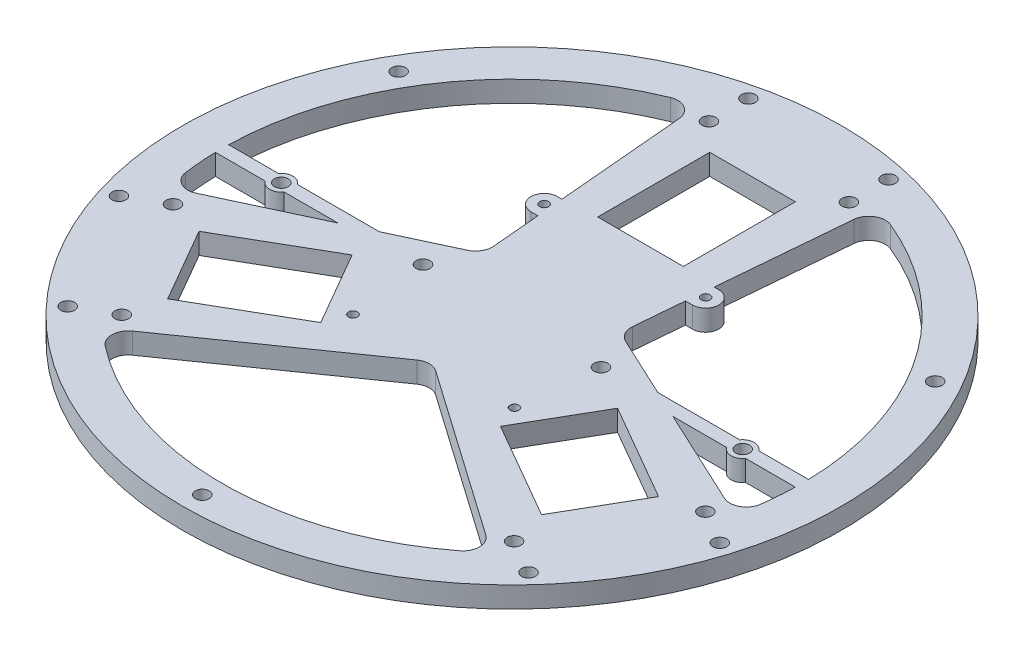
from build123d import *

# Parameters (mm, degrees)
BOSS_EXTRUDE1_OUTLINE_R   = 100
BOSS_EXTRUDE1_OUTLINE_R_2 = 2.1
BOSS_EXTRUDE1_OUTLINE_W   = 26
BOSS_EXTRUDE1_OUTLINE_H   = 34
BOSS_EXTRUDE1_DEPTH       = 6.35
SKETCH2_R                 = 2.1
CUT_EXTRUDE1_DEPTH        = 6.35
CUT_EXTRUDE4_DEPTH        = 6.35
BOSS_EXTRUDE2_DEPTH       = 6.35
SKETCH4_R                 = 1.35
CUT_EXTRUDE3_DEPTH        = 6.35
SKETCH7_R                 = 2.1
BOSS_EXTRUDE3_DEPTH       = 6.35
SKETCH8_R                 = 2.1
CUT_EXTRUDE5_DEPTH        = 6.35


# Read off the part's stored shape, not the designer's step: Boss-Extrude1
with BuildPart() as part:
    # Boss-Extrude1 outline → Boss-Extrude1 (new body)
    with BuildSketch(Plane(origin=(0, 0, 0), x_dir=(1, 0, 0), z_dir=(0, 1, 0))):
        Circle(BOSS_EXTRUDE1_OUTLINE_R)
        with Locations((-69.915362552, -64.90303983)):
            Circle(BOSS_EXTRUDE1_OUTLINE_R_2, mode=Mode.SUBTRACT)
        with Locations((-59.523057707, -58.90303983)):
            Circle(BOSS_EXTRUDE1_OUTLINE_R_2, mode=Mode.SUBTRACT)
        with Locations((-91.165362552, -28.09696017)):
            Circle(BOSS_EXTRUDE1_OUTLINE_R_2, mode=Mode.SUBTRACT)
        with Locations((-80.773057707, -22.09696017)):
            Circle(BOSS_EXTRUDE1_OUTLINE_R_2, mode=Mode.SUBTRACT)
        Polygon((-56.719854476, -47.758330249), (-69.719854476, -25.241669751), (-40.274990748, -8.241669751), (-27.274990748, -30.758330249), align=None, mode=Mode.SUBTRACT)
        with Locations((69.915362552, -64.90303983)):
            Circle(BOSS_EXTRUDE1_OUTLINE_R_2, mode=Mode.SUBTRACT)
        with Locations((59.523057707, -58.90303983)):
            Circle(BOSS_EXTRUDE1_OUTLINE_R_2, mode=Mode.SUBTRACT)
        Polygon((69.719854476, -25.241669751), (56.719854476, -47.758330249), (27.274990748, -30.758330249), (40.274990748, -8.241669751), align=None, mode=Mode.SUBTRACT)
        with Locations((91.165362552, -28.09696017)):
            Circle(BOSS_EXTRUDE1_OUTLINE_R_2, mode=Mode.SUBTRACT)
        with Locations((80.773057707, -22.09696017)):
            Circle(BOSS_EXTRUDE1_OUTLINE_R_2, mode=Mode.SUBTRACT)
        with Locations((-21.25, 81)):
            Circle(BOSS_EXTRUDE1_OUTLINE_R_2, mode=Mode.SUBTRACT)
        with Locations((-21.25, 93)):
            Circle(BOSS_EXTRUDE1_OUTLINE_R_2, mode=Mode.SUBTRACT)
        with Locations((0, 56)):
            Rectangle(BOSS_EXTRUDE1_OUTLINE_W, BOSS_EXTRUDE1_OUTLINE_H, mode=Mode.SUBTRACT)
        with Locations((21.25, 81)):
            Circle(BOSS_EXTRUDE1_OUTLINE_R_2, mode=Mode.SUBTRACT)
        with Locations((21.25, 93)):
            Circle(BOSS_EXTRUDE1_OUTLINE_R_2, mode=Mode.SUBTRACT)
    extrude(amount=BOSS_EXTRUDE1_DEPTH)

    # Sketch2 → Cut-Extrude1 (cut)
    with BuildSketch(Plane(origin=(0, 6.35, 0), x_dir=(1, 0, 0), z_dir=(0, 1, 0))):
        with Locations(Location((0, -94, 0), (0, 0, 270))):
            Circle(SKETCH2_R)
        with Locations(Location((-81.406387956, 47, 0), (0, 0, 270))):
            Circle(SKETCH2_R)
        with Locations(Location((81.406387956, 47, 0), (0, 0, 270))):
            Circle(SKETCH2_R)
    extrude(amount=-CUT_EXTRUDE1_DEPTH, mode=Mode.SUBTRACT)

    # Sketch5 → Cut-Extrude4 (cut)
    with BuildSketch(Plane(origin=(0, 6.35, 0), x_dir=(1, 0, 0), z_dir=(0, 1, 0))):
        with BuildLine():
            Line((26.502570178, 77.23282604), (21.101148971, 15.494299138))
            ThreePointArc((21.101148971, 15.494299138), (21.751995443, 12.558520424), (23.969031153, 10.526981489))
            Line((23.969031153, 10.526981489), (80.136874446, -15.664513981))
            ThreePointArc((80.136874446, -15.664513981), (84.646931723, -15.520976202), (87.204782969, -11.803636193))
            ThreePointArc((87.204782969, -11.803636193), (76.210235533, 44), (33.380142684, 81.423375479))
            ThreePointArc((33.380142684, 81.423375479), (28.881906179, 81.066881325), (26.502570178, 77.23282604))
        make_face()
        with BuildLine():
            Line((53.634304268, -61.56831206), (2.867882182, -26.021280627))
            ThreePointArc((2.867882182, -26.021280627), (0, -25.117040848), (-2.867882182, -26.021280627))
            Line((-2.867882182, -26.021280627), (-53.634304268, -61.56831206))
            ThreePointArc((-53.634304268, -61.56831206), (-55.765025544, -65.545905124), (-53.824640284, -69.619739286))
            ThreePointArc((-53.824640284, -69.619739286), (0, -88), (53.824640284, -69.619739286))
            ThreePointArc((53.824640284, -69.619739286), (55.765025544, -65.545905124), (53.634304268, -61.56831206))
        make_face()
        with BuildLine():
            Line((-80.136874446, -15.664513981), (-23.969031153, 10.526981489))
            ThreePointArc((-23.969031153, 10.526981489), (-21.751995443, 12.558520424), (-21.101148971, 15.494299138))
            Line((-21.101148971, 15.494299138), (-26.502570178, 77.23282604))
            ThreePointArc((-26.502570178, 77.23282604), (-28.881906179, 81.066881325), (-33.380142684, 81.423375479))
            ThreePointArc((-33.380142684, 81.423375479), (-76.210235533, 44), (-87.204782969, -11.803636193))
            ThreePointArc((-87.204782969, -11.803636193), (-84.646931723, -15.520976202), (-80.136874446, -15.664513981))
        make_face()
    extrude(amount=-CUT_EXTRUDE4_DEPTH, mode=Mode.SUBTRACT)

    # Sketch6 → Boss-Extrude2 (add)
    with BuildSketch(Plane(origin=(0, 6.35, 0), x_dir=(1, 0, 0), z_dir=(0, 1, 0))):
        with BuildLine():
            Line((-24.5, 38.25), (-23.092014827, 38.25))
            Line((-23.092014827, 38.25), (-22.392105519, 30.25))
            Line((-22.392105519, 30.25), (-24.5, 30.25))
            ThreePointArc((-24.5, 30.25), (-28.5, 34.25), (-24.5, 38.25))
        make_face()
        with BuildLine():
            Line((22.392105519, 30.25), (24.5, 30.25))
            ThreePointArc((24.5, 30.25), (28.5, 34.25), (24.5, 38.25))
            Line((24.5, 38.25), (23.092014827, 38.25))
            Line((23.092014827, 38.25), (22.392105519, 30.25))
        make_face()
    extrude(amount=-BOSS_EXTRUDE2_DEPTH)

    # Sketch4 → Cut-Extrude3 (cut)
    with BuildSketch(Plane(origin=(0, 6.35, 0), x_dir=(1, 0, 0), z_dir=(0, 1, 0))):
        with Locations(Location((-24.5, -23.75, 0), (0, 0, 270))):
            Circle(SKETCH4_R)
        with Locations(Location((24.5, -23.75, 0), (0, 0, 270))):
            Circle(SKETCH4_R)
        with Locations(Location((24.5, 34.25, 0), (0, 0, 270))):
            Circle(SKETCH4_R)
        with Locations(Location((-24.5, 34.25, 0), (0, 0, 270))):
            Circle(SKETCH4_R)
    extrude(amount=-CUT_EXTRUDE3_DEPTH, mode=Mode.SUBTRACT)

    # Sketch7 → Boss-Extrude3 (add)
    # profile 1 of 2: a face of its own
    with BuildSketch(Plane(origin=(0, 6.35, 0), x_dir=(1, 0, 0), z_dir=(0, 1, 0))):
        with BuildLine():
            Line((67.127718677, 2), (17.894755671, 2))
            Line((17.894755671, 2), (17.894755671, -2))
            Line((17.894755671, -2), (67.127718677, -2))
            ThreePointArc((67.127718677, -2), (70, -3.5), (72.872281323, -2))
            Line((72.872281323, -2), (93.633289792, -2))
            Line((93.633289792, -2), (93.633289792, 2))
            Line((93.633289792, 2), (72.872281323, 2))
            ThreePointArc((72.872281323, 2), (70, 3.5), (67.127718677, 2))
        make_face()
        with Locations(Location((70, 0, 0), (0, 0, 270))):
            Circle(SKETCH7_R, mode=Mode.SUBTRACT)
    # profile 2 of 2: a face of its own
    with BuildSketch(Plane(origin=(0, 6.35, 0), x_dir=(1, 0, 0), z_dir=(0, 1, 0))):
        with BuildLine():
            Line((-72.872281323, -2), (-93.633289792, -2))
            Line((-93.633289792, -2), (-93.633289792, 2))
            Line((-93.633289792, 2), (-72.872281323, 2))
            ThreePointArc((-72.872281323, 2), (-70, 3.5), (-67.127718677, 2))
            Line((-67.127718677, 2), (-17.894755671, 2))
            Line((-17.894755671, 2), (-17.894755671, -2))
            Line((-17.894755671, -2), (-67.127718677, -2))
            ThreePointArc((-67.127718677, -2), (-70, -3.5), (-72.872281323, -2))
        make_face()
        with Locations(Location((-70, 0, 0), (0, 0, 270))):
            Circle(SKETCH7_R, mode=Mode.SUBTRACT)
    extrude(amount=-BOSS_EXTRUDE3_DEPTH)

    # Sketch8 → Cut-Extrude5 (cut)
    with BuildSketch(Plane(origin=(0, 6.35, 0), x_dir=(1, 0, 0), z_dir=(0, 1, 0))):
        with Locations(Location((27, 0, 0), (0, 0, 270))):
            Circle(SKETCH8_R)
        with Locations(Location((-27, 0, 0), (0, 0, 270))):
            Circle(SKETCH8_R)
    extrude(amount=-CUT_EXTRUDE5_DEPTH, mode=Mode.SUBTRACT)


solid = part.part
